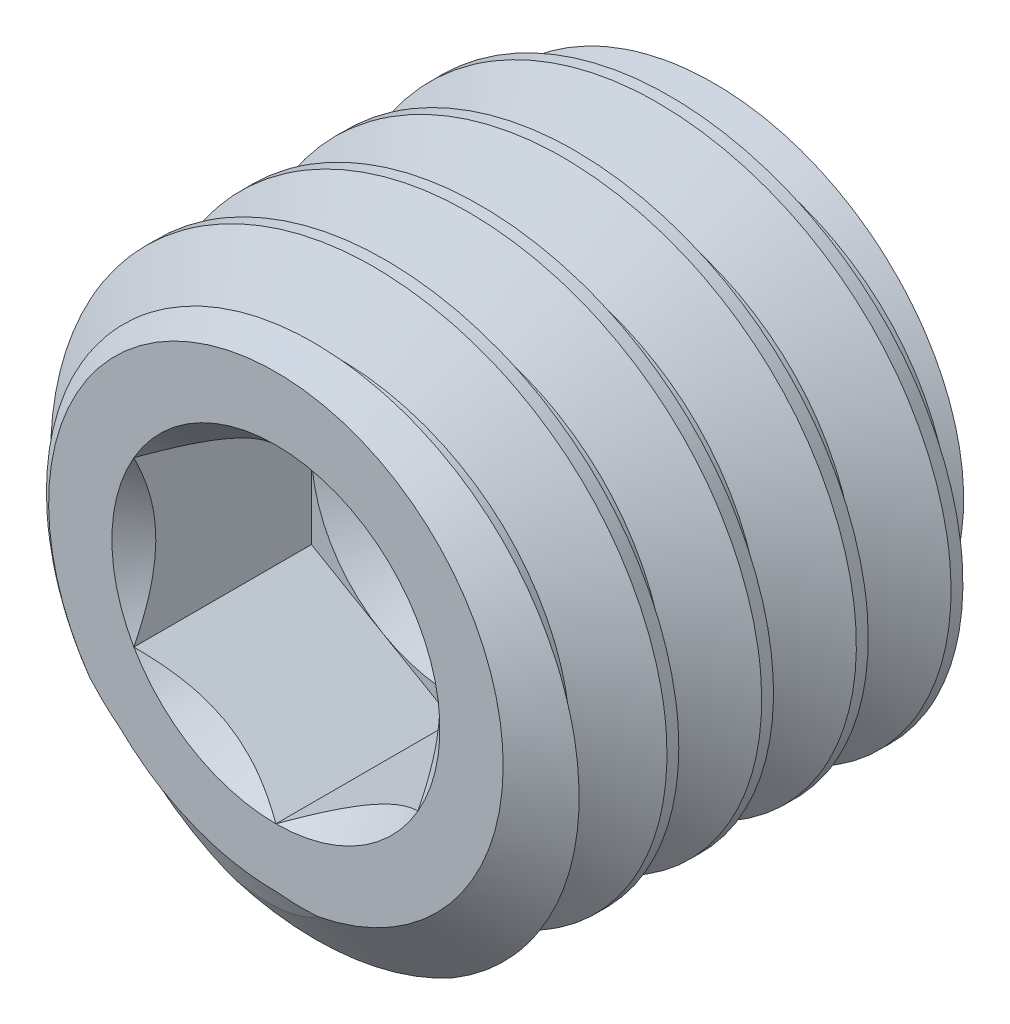
from build123d import *

# Parameters (mm, degrees)
HEX_EXTRUDE_DEPTH  = 0.9375
THREAD_SWEEP_PITCH = 0.5


with BuildPart() as part:
    # Body Sketch → Body Revolve (revolve)
    with BuildSketch(Plane(origin=(0, 0, 0), x_dir=(0, 0, -1), z_dir=(1, 0, 0)), mode=Mode.PRIVATE) as body_revolve_sk:
        Polygon((-1.5, 0), (-1.5, 1.2), (-1.289937739, 1.5), (0.746557899, 1.5), (1.5, 0.195), (1.5, 0), align=None)
    revolve(body_revolve_sk.sketch.rotate(Axis((0, 0, -1.5), (0, 0, 1)), 90), axis=Axis((0, 0, -1.5), (0, 0, 1)))

    # Hex Sketch → Hex Extrude (cut)
    with BuildSketch(Plane.XY.offset(1.5)):
        Polygon((0, 0.866025404), (-0.75, 0.433012702), (-0.75, -0.433012702), (0, -0.866025404), (0.75, -0.433012702), (0.75, 0.433012702), align=None)
    extrude(amount=-HEX_EXTRUDE_DEPTH, mode=Mode.SUBTRACT)

    # Hex Entry Extrude cone 1 section (through the dimple's axis) → Hex Entry Extrude (revolve, cut)
    with BuildSketch(Plane(origin=(0, 0, 1.5), x_dir=(0, -1, 0), z_dir=(1, 0, 0))):
        Polygon((0, 0), (0.866025404, 0), (0, 0.866025404), align=None)
    revolve(axis=Axis((0, 0, 1.5), (0, 0, -1)), mode=Mode.SUBTRACT)

    # Hex Bottom Extrude cone 1 section (through the dimple's axis) → Hex Bottom Extrude (revolve, cut)
    with BuildSketch(Plane(origin=(0, 0, 0.5625), x_dir=(0, -1, 0), z_dir=(1, 0, 0))):
        Polygon((0, 0), (0.75, 0), (0, 0.433012702), align=None)
    revolve(axis=Axis((0, 0, 0.5625), (0, 0, -1)), mode=Mode.SUBTRACT)

    # Thread Sweep: the profile of Sketch28 profile screwed along a right-hand helix of 7 turns, 6 arcs to a turn; built about Z, then put on its axis
    thread_sweep_z = Axis((0, 0, 0), (0, 0, 1))
    thread_sweep_corners = [(1.5003, 0, 0.000173205), (1.5003, 0, -0.437673205), (1.175240474, 0, -0.25), (1.175240474, 0, -0.1875)]
    with BuildLine(mode=Mode.PRIVATE) as thread_sweep_profile:
        Line(thread_sweep_corners[0], thread_sweep_corners[1])
        Line(thread_sweep_corners[1], thread_sweep_corners[2])
        Line(thread_sweep_corners[2], thread_sweep_corners[3])
        Line(thread_sweep_corners[3], thread_sweep_corners[0])
    thread_sweep_cap = Face(thread_sweep_profile.wire())
    thread_sweep_turn_angles = [0, 30, 60, 90, 120, 150, 180, 210, 240, 270, 300, 330, 360]
    thread_sweep_turn_weights = [1, 0.8660254037844387, 1, 0.8660254037844387, 1, 0.8660254037844387, 1, 0.8660254037844387, 1, 0.8660254037844387, 1, 0.8660254037844387, 1]
    thread_sweep_turn_rails = [Edge.make_bspline([Vector(p[0], p[1], 0).rotate(thread_sweep_z, thread_sweep_turn_angles[k]) / thread_sweep_turn_weights[k] + Vector(0, 0, p[2] + THREAD_SWEEP_PITCH * thread_sweep_turn_angles[k] / 360) for k in range(13)], [0, 0, 0, 1, 1, 2, 2, 3, 3, 4, 4, 5, 5, 6, 6, 6], 2, thread_sweep_turn_weights) for p in thread_sweep_corners]
    thread_sweep_turn_sides = [Face.make_surface_from_curves(thread_sweep_turn_rails[p[0]], thread_sweep_turn_rails[p[1]]) for p in [(0, 1), (1, 2), (2, 3), (3, 0)]]
    thread_sweep = Plane(origin=(0, 0, -1.5), x_dir=(0, 1, 0), z_dir=(0, 0, 1)) * Solid(Shell([*[p.moved(Location((0, 0, THREAD_SWEEP_PITCH * i))) for i in range(7) for p in thread_sweep_turn_sides], thread_sweep_cap, thread_sweep_cap.rotate(thread_sweep_z, 2520).moved(Location((0, 0, THREAD_SWEEP_PITCH * 2520 / 360)))]))
    add(thread_sweep, mode=Mode.SUBTRACT)


solid = part.part
